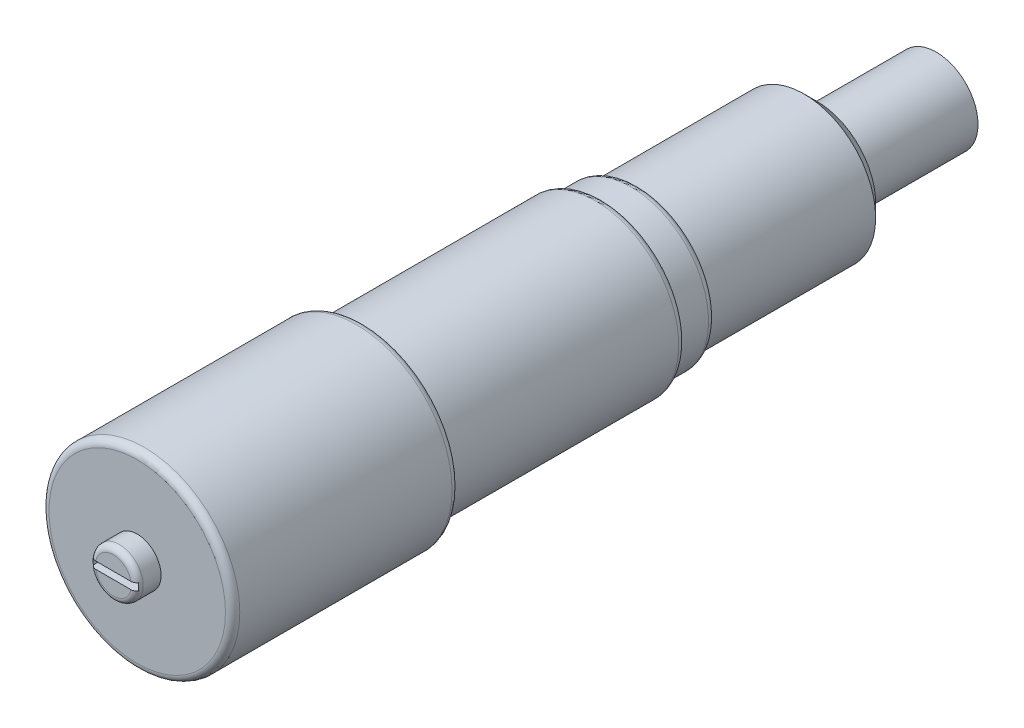
from build123d import *

# Parameters (mm, degrees)
SKETCH_1_R          = 1.75
EXTRUDE_1_DEPTH     = 5
SKETCH_2_R          = 3.5
EXTRUDE_2_DEPTH     = 4
SKETCH_3_R          = 3.5
EXTRUDE_3_DEPTH     = 1
CUT_EXTRUDE_START   = -1
SKETCH_25_R         = 3.5
CUT_EXTRUDE_1_DEPTH = 1
SKETCH_26_R         = 3
EXTRUDE_8_DEPTH     = 3.5
SKETCH_27_R         = 3.25
EXTRUDE_9_DEPTH     = 1.5
SKETCH_28_R         = 3.5
EXTRUDE_10_DEPTH    = 10
SKETCH_29_R         = 4
EXTRUDE_11_DEPTH    = 9.5
SKETCH_30_R         = 1
EXTRUDE_12_DEPTH    = 1
FILLET_1_R          = 0.25
FILLET_2_R          = 0.3
SKETCH_31_W         = 1.9
SKETCH_31_H         = 0.3
CUT_EXTRUDE_2_DEPTH = 0.5


# Read off the part's stored shape, not the designer's step: M6 机械螺纹 螺柱5
with BuildPart() as part:
    # 草图1 → 凸台-拉伸1 (new body)
    with BuildSketch(Plane.XY):
        Circle(SKETCH_1_R)
    extrude(amount=EXTRUDE_1_DEPTH)

    # 草图2 → 凸台-拉伸2 (add)
    with BuildSketch(Plane.XY.offset(5)):
        Circle(SKETCH_2_R)
    extrude(amount=EXTRUDE_2_DEPTH)

    # 草图3 → 凸台-拉伸3 (add)
    with BuildSketch(Plane.XY.offset(9)):
        Circle(SKETCH_3_R)
    extrude(amount=EXTRUDE_3_DEPTH)

    # M6 机械螺纹 螺柱5 outline → M6 机械螺纹 螺柱5 (revolve, cut)
    with BuildSketch(Plane.XZ):
        Polygon((2.4585, 5), (3.5, 5), (3.5, 9), (3, 9), (3, 5.5415), align=None)
    revolve(axis=Axis((0, 0, 0), (0, 0, 1)), mode=Mode.SUBTRACT)

    # 草图25 → 切除-拉伸1 (cut)
    with BuildSketch(Plane.XY.offset(10).offset(CUT_EXTRUDE_START)):
        Circle(SKETCH_25_R)
    extrude(amount=CUT_EXTRUDE_1_DEPTH, mode=Mode.SUBTRACT)

    # 草图26 → 凸台-拉伸8 (add)
    with BuildSketch(Plane.XY.offset(9)):
        Circle(SKETCH_26_R)
    extrude(amount=EXTRUDE_8_DEPTH)

    # 草图27 → 凸台-拉伸9 (add)
    with BuildSketch(Plane.XY.offset(12.5)):
        Circle(SKETCH_27_R)
    extrude(amount=EXTRUDE_9_DEPTH)

    # 草图28 → 凸台-拉伸10 (add)
    with BuildSketch(Plane.XY.offset(14)):
        Circle(SKETCH_28_R)
    extrude(amount=EXTRUDE_10_DEPTH)

    # 草图29 → 凸台-拉伸11 (add)
    with BuildSketch(Plane.XY.offset(24)):
        Circle(SKETCH_29_R)
    extrude(amount=EXTRUDE_11_DEPTH)

    # 草图30 → 凸台-拉伸12 (add)
    with BuildSketch(Plane.XY.offset(33.5)):
        Circle(SKETCH_30_R)
    extrude(amount=EXTRUDE_12_DEPTH)

    # 圆角1
    fillet_1_edges = [part.edges().sort_by_distance(p)[0] for p in [
        (-1, 0, 34.5),
    ]]
    fillet(fillet_1_edges, radius=FILLET_1_R)

    # 圆角2
    # the kernel refuses this fillet: 0.3 mm, written as the material it takes off along each edge
    with BuildSketch(Plane(origin=(0, 0, 12.5), x_dir=(1, 0, 0), z_dir=(0, -1, 0))) as fillet_2_piece_1:
        with BuildLine():
            CenterArc((2.95, 0.295803989), FILLET_2_R, 279.594068227, 80.405931773)
            Line((3, 0), (3.001, -0.00591608))
            ThreePointArc((3.001, -0.00591608), (3.125, -0.006), (3.25, -0.006))
            Line((3.25, -0.006), (3.256, 0))
            Line((3.256, 0), (3.256, 0.295803989))
            Line((3.256, 0.295803989), (3.25, 0.295803989))
        make_face()
    revolve(axis=Axis((0, 0, 12.5), (0, 0, 1)), mode=Mode.SUBTRACT)
    with BuildSketch(Plane(origin=(0, 0, 14), x_dir=(1, 0, 0), z_dir=(0, -1, 0))) as fillet_2_piece_2:
        with BuildLine():
            CenterArc((3.2, 0.295803989), FILLET_2_R, 279.594068227, 80.405931773)
            Line((3.25, 0), (3.251, -0.00591608))
            ThreePointArc((3.251, -0.00591608), (3.375, -0.006), (3.5, -0.006))
            Line((3.5, -0.006), (3.506, 0))
            Line((3.506, 0), (3.506, 0.295803989))
            Line((3.506, 0.295803989), (3.5, 0.295803989))
        make_face()
    revolve(axis=Axis((0, 0, 14), (0, 0, 1)), mode=Mode.SUBTRACT)
    with BuildSketch(Plane(origin=(0, 0, 24), x_dir=(1, 0, 0), z_dir=(0, -1, 0))) as fillet_2_piece_3:
        with BuildLine():
            CenterArc((4 - FILLET_2_R, FILLET_2_R), FILLET_2_R, 270, 90)
            Line((4 - FILLET_2_R, 0), (4 - FILLET_2_R, -FILLET_2_R * 0.02))
            Line((4 - FILLET_2_R, -FILLET_2_R * 0.02), (4 + FILLET_2_R * 0.02, -FILLET_2_R * 0.02))
            Line((4 + FILLET_2_R * 0.02, -FILLET_2_R * 0.02), (4 + FILLET_2_R * 0.02, FILLET_2_R))
            Line((4 + FILLET_2_R * 0.02, FILLET_2_R), (4, FILLET_2_R))
        make_face()
    revolve(axis=Axis((0, 0, 24), (0, 0, 1)), mode=Mode.SUBTRACT)
    with BuildSketch(Plane(origin=(0, 0, 33.5), x_dir=(1, 0, 0), z_dir=(0, -1, 0))) as fillet_2_piece_4:
        with BuildLine():
            CenterArc((4 - FILLET_2_R, -FILLET_2_R), FILLET_2_R, 0, 90)
            Line((4, -FILLET_2_R), (4 + FILLET_2_R * 0.02, -FILLET_2_R))
            Line((4 + FILLET_2_R * 0.02, -FILLET_2_R), (4 + FILLET_2_R * 0.02, FILLET_2_R * 0.02))
            Line((4 + FILLET_2_R * 0.02, FILLET_2_R * 0.02), (4 - FILLET_2_R, FILLET_2_R * 0.02))
            Line((4 - FILLET_2_R, FILLET_2_R * 0.02), (4 - FILLET_2_R, 0))
        make_face()
    revolve(axis=Axis((0, 0, 33.5), (0, 0, 1)), mode=Mode.SUBTRACT)

    # 草图31 → 切除-拉伸2 (cut)
    with BuildSketch(Plane.XY.offset(34.5)):
        Rectangle(SKETCH_31_W, SKETCH_31_H)
    extrude(amount=-CUT_EXTRUDE_2_DEPTH, mode=Mode.SUBTRACT)


solid = part.part
